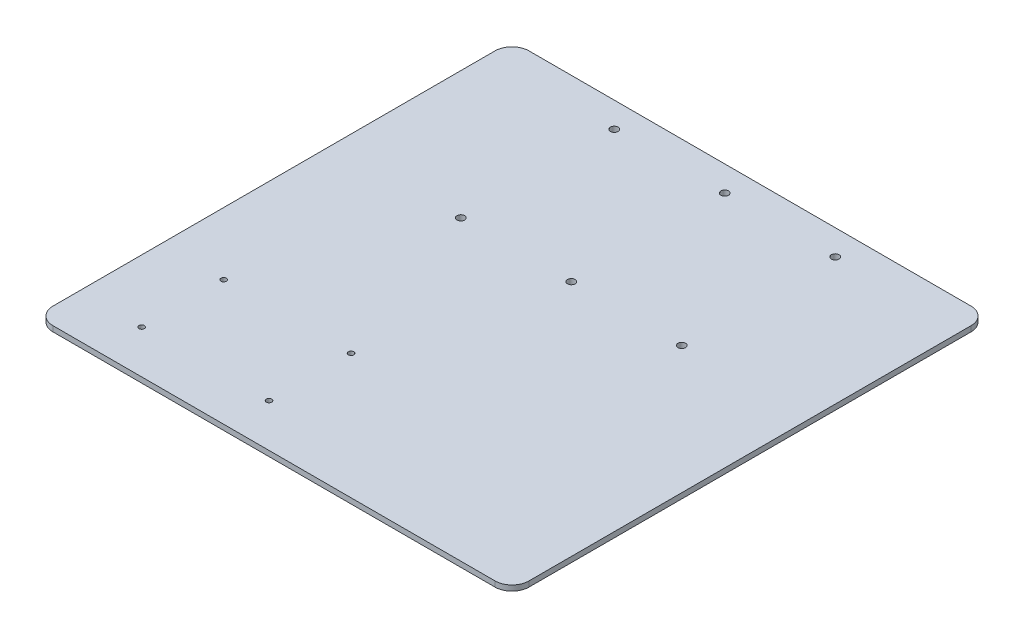
from build123d import *

# Parameters (mm, degrees)
SKETCH1_W          = 280
SKETCH1_H          = 280
BASE_FLANGE1_DEPTH = 3.18
SKETCH6_R          = 2.25
SKETCH6_R_2        = 1.6
CUT_EXTRUDE1_DEPTH = 10
FILLET1_R          = 10


# Sheet-metal steps are written as plain solids
with BuildPart() as part:
    # Sketch1 → Base-Flange1 (new body)
    with BuildSketch(Plane(origin=(0, 0, 0), x_dir=(1, 0, 0), z_dir=(0, 1, 0))):
        Rectangle(SKETCH1_W, SKETCH1_H)
    extrude(amount=-BASE_FLANGE1_DEPTH)

    # Sketch6 → Cut-Extrude1 (cut)
    with BuildSketch(Plane(origin=(0, 0, 0), x_dir=(1, 0, 0), z_dir=(0, 1, 0))):
        with Locations(Location((0, 125.125, 0), (0, 0, 270))):
            Circle(SKETCH6_R)
        with Locations(Location((0, 34.875, 0), (0, 0, 270))):
            Circle(SKETCH6_R)
        with Locations(Location((65, 34.875, 0), (0, 0, 270))):
            Circle(SKETCH6_R)
        with Locations(Location((65, 125.125, 0), (0, 0, 270))):
            Circle(SKETCH6_R)
        with Locations(Location((-103.215, -114.63, 0), (0, 0, 270))):
            Circle(SKETCH6_R_2)
        with Locations(Location((-28.285, -114.63, 0), (0, 0, 270))):
            Circle(SKETCH6_R_2)
        with Locations(Location((-28.285, -66.37, 0), (0, 0, 270))):
            Circle(SKETCH6_R_2)
        with Locations(Location((-103.215, -66.37, 0), (0, 0, 270))):
            Circle(SKETCH6_R_2)
        with Locations(Location((-65, 34.875, 0), (0, 0, 270))):
            Circle(SKETCH6_R)
        with Locations(Location((-65, 125.125, 0), (0, 0, 270))):
            Circle(SKETCH6_R)
    extrude(amount=-CUT_EXTRUDE1_DEPTH, mode=Mode.SUBTRACT)

    # Fillet1
    fillet1_edges = [part.edges().sort_by_distance(p)[0] for p in [
        (140, -1.59, 140),
        (-140, -1.59, 140),
        (-140, -1.59, -140),
        (140, -1.59, -140),
    ]]
    fillet(fillet1_edges, radius=FILLET1_R)


solid = part.part
